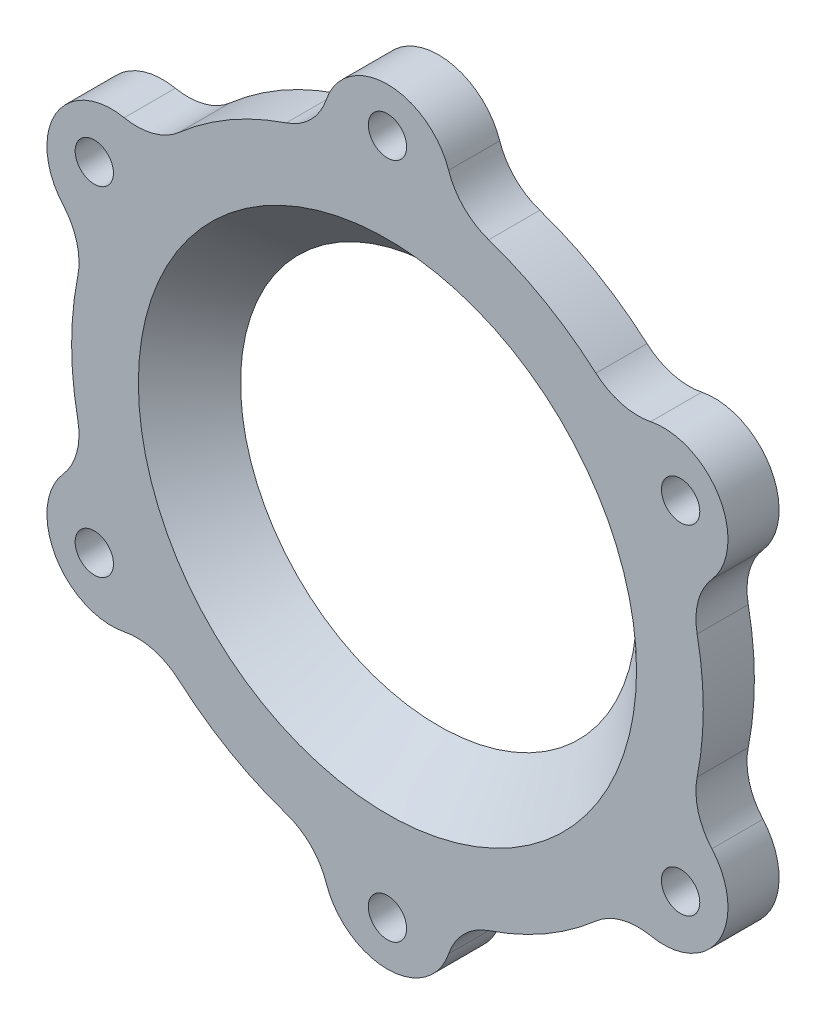
from build123d import *

# Parameters (mm, degrees)
SKETCH2_R           = 3
SKETCH2_R_2         = 31
BOSS_EXTRUDE1_DEPTH = 8
CHAMFER1_SIZE       = 8


with BuildPart() as part:
    # Sketch2 → Boss-Extrude1 (new body)
    with BuildSketch(Plane.XY):
        with BuildLine():
            ThreePointArc((50.792573497, 18.265840665), (51.961524227, 30), (41.214968786, 34.85473864))
            ThreePointArc((41.214968786, 34.85473864), (36.65999643, 34.997336465), (32.641290086, 37.146314508))
            ThreePointArc((32.641290086, 37.146314508), (24.725, 42.824956217), (15.849006977, 46.841343681))
            ThreePointArc((15.849006977, 46.841343681), (11.978584229, 49.247156444), (9.577604711, 53.120579305))
            ThreePointArc((9.577604711, 53.120579305), (0, 60), (-9.577604711, 53.120579305))
            ThreePointArc((-9.577604711, 53.120579305), (-11.978584229, 49.247156444), (-15.849006977, 46.841343681))
            ThreePointArc((-15.849006977, 46.841343681), (-24.725, 42.824956217), (-32.641290086, 37.146314508))
            ThreePointArc((-32.641290086, 37.146314508), (-36.65999643, 34.997336465), (-41.214968786, 34.85473864))
            ThreePointArc((-41.214968786, 34.85473864), (-51.961524227, 30), (-50.792573497, 18.265840665))
            ThreePointArc((-50.792573497, 18.265840665), (-48.638580659, 14.249819979), (-48.490297064, 9.695029173))
            ThreePointArc((-48.490297064, 9.695029173), (-49.45, 0), (-48.490297064, -9.695029173))
            ThreePointArc((-48.490297064, -9.695029173), (-48.638580659, -14.249819979), (-50.792573497, -18.265840665))
            ThreePointArc((-50.792573497, -18.265840665), (-51.961524227, -30), (-41.214968786, -34.85473864))
            ThreePointArc((-41.214968786, -34.85473864), (-36.65999643, -34.997336465), (-32.641290086, -37.146314508))
            ThreePointArc((-32.641290086, -37.146314508), (-24.725, -42.824956217), (-15.849006977, -46.841343681))
            ThreePointArc((-15.849006977, -46.841343681), (-11.978584229, -49.247156444), (-9.577604711, -53.120579305))
            ThreePointArc((-9.577604711, -53.120579305), (0, -60), (9.577604711, -53.120579305))
            ThreePointArc((9.577604711, -53.120579305), (11.978584229, -49.247156444), (15.849006977, -46.841343681))
            ThreePointArc((15.849006977, -46.841343681), (24.725, -42.824956217), (32.641290086, -37.146314508))
            ThreePointArc((32.641290086, -37.146314508), (36.65999643, -34.997336465), (41.214968786, -34.85473864))
            ThreePointArc((41.214968786, -34.85473864), (51.961524227, -30), (50.792573497, -18.265840665))
            ThreePointArc((50.792573497, -18.265840665), (48.638580659, -14.249819979), (48.490297064, -9.695029173))
            ThreePointArc((48.490297064, -9.695029173), (49.45, 0), (48.490297064, 9.695029173))
            ThreePointArc((48.490297064, 9.695029173), (48.638580659, 14.249819979), (50.792573497, 18.265840665))
        make_face()
        with Locations((45.899346401, 26.5)):
            Circle(SKETCH2_R, mode=Mode.SUBTRACT)
        with Locations((0, 53)):
            Circle(SKETCH2_R, mode=Mode.SUBTRACT)
        Circle(SKETCH2_R_2, mode=Mode.SUBTRACT)
        with Locations((45.899346401, -26.5)):
            Circle(SKETCH2_R, mode=Mode.SUBTRACT)
        with Locations((0, -53)):
            Circle(SKETCH2_R, mode=Mode.SUBTRACT)
        with Locations((-45.899346401, 26.5)):
            Circle(SKETCH2_R, mode=Mode.SUBTRACT)
        with Locations((-45.899346401, -26.5)):
            Circle(SKETCH2_R, mode=Mode.SUBTRACT)
    extrude(amount=BOSS_EXTRUDE1_DEPTH)

    # Chamfer1
    chamfer1_edges = [part.edges().sort_by_distance(p)[0] for p in [
        (-31, 0, 8),
    ]]
    chamfer(chamfer1_edges, length=CHAMFER1_SIZE - 0.0001)  # a hair under: the kernel refuses the full size


solid = part.part
